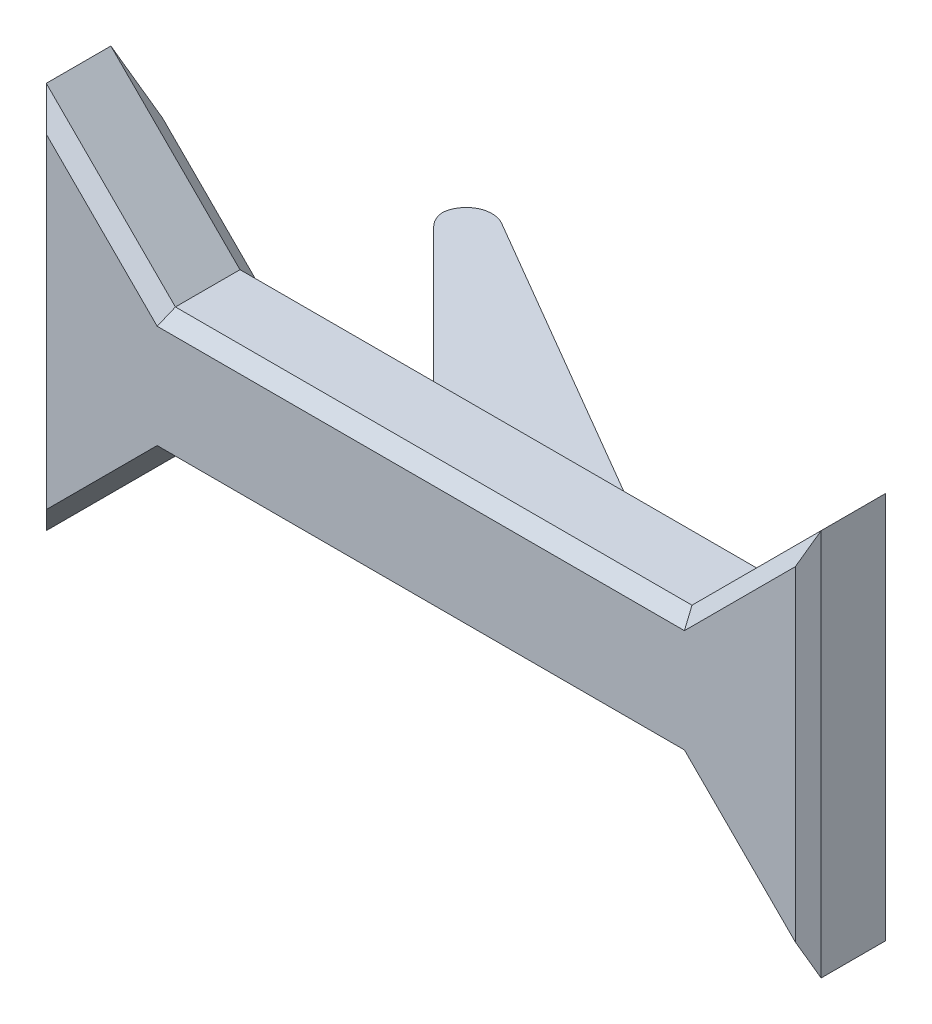
from build123d import *

# Parameters (mm, degrees)
SKETCH1_W           = 20
SKETCH1_H           = 5
BOSS_EXTRUDE1_DEPTH = 4
BOSS_EXTRUDE2_DEPTH = 2
CHAMFER1_SIZE       = 0.5
CHAMFER2_SIZE       = 1
CHAMFER3_SIZE       = 1
CHAMFER3_SIZE2      = 0.707106781
FILLET5_R           = 1


with BuildPart() as part:
    # Sketch1 → Boss-Extrude1 (new body)
    with BuildSketch(Plane.XY):
        Polygon((-15, 7.5), (-15, -7.5), (-10, -2.5), (-10, 2.5), align=None)
        Rectangle(SKETCH1_W, SKETCH1_H)
        Polygon((10, 2.5), (15, 7.5), (15, -7.5), (10, -2.5), align=None)
    extrude(amount=BOSS_EXTRUDE1_DEPTH)

    # Sketch4 → Boss-Extrude2 (add, symmetric)
    with BuildSketch(Plane(origin=(0, 0, 0), x_dir=(1, 0, 0), z_dir=(0, 1, 0))):
        Polygon((3.5, 0), (-8.5, 7), (-8.5, 5), (-3.5, 0), align=None)
    extrude(amount=BOSS_EXTRUDE2_DEPTH, both=True)

    # Chamfer1
    chamfer1_edges = [part.edges().sort_by_distance(p)[0] for p in [
        (-12.5, -5, 4),
        (0, -2.5, 4),
        (12.5, -5, 4),
        (15, 0, 4),
        (12.5, 5, 4),
        (0, 2.5, 4),
        (-12.5, 5, 4),
        (-15, 0, 4),
    ]]
    chamfer(chamfer1_edges, length=CHAMFER1_SIZE)

    # Chamfer2
    # the kernel refuses this chamfer: 1 mm, written as the material it takes off along each edge
    with BuildSketch(Plane(origin=(16.81845448, -9.31845448, 0), x_dir=(0.7071067811865414, 0.7071067811865538, 0), z_dir=(-0.7071067811865538, 0.7071067811865415, 0))) as chamfer2_piece_1_section:
        Polygon((CHAMFER2_SIZE, 0), (0, -CHAMFER2_SIZE), (0, 0), align=None)
    chamfer2_piece_1 = extrude(amount=12.214433788, mode=Mode.PRIVATE)
    chamfer2_piece_1 = split(chamfer2_piece_1, bisect_by=Plane(origin=(16.81845448, -5.40922724, 3.90922724), z_dir=(0, -0.7071067811865476, -0.7071067811865476)), keep=Keep.TOP, mode=Mode.PRIVATE)
    add(chamfer2_piece_1, mode=Mode.SUBTRACT)
    with BuildSketch(Plane(origin=(15, 10.071682988, 0), x_dir=(-1, 0, 0), z_dir=(0, -1, 0)), Plane(origin=(-15, 10.071682988, 0), x_dir=(0, 0, 1), z_dir=(0, -1, 0))) as chamfer2_piece_2:
        Polygon((CHAMFER2_SIZE, 0), (0, -CHAMFER2_SIZE), (0, 0), align=None)
    extrude(amount=20.143365976, mode=Mode.SUBTRACT)
    with BuildSketch(Plane(origin=(8.18154552, 0.68154552, 0), x_dir=(0.707106781186537, -0.7071067811865581, 0), z_dir=(0.7071067811865581, 0.707106781186537, 0))) as chamfer2_piece_3_section:
        Polygon((CHAMFER2_SIZE, 0), (0, -CHAMFER2_SIZE), (0, 0), align=None)
    chamfer2_piece_3 = extrude(amount=12.214433788, mode=Mode.PRIVATE)
    chamfer2_piece_3 = split(chamfer2_piece_3, bisect_by=Plane(origin=(8.18154552, 1.09077276, -0.40922724), z_dir=(0, 0.7071067811865476, -0.7071067811865476)), keep=Keep.TOP, mode=Mode.PRIVATE)
    add(chamfer2_piece_3, mode=Mode.SUBTRACT)
    with BuildSketch(Plane(origin=(12.571682988, 2.5, 0), x_dir=(0, -1, 0), z_dir=(-1, 0, 0))) as chamfer2_piece_4_section:
        Polygon((CHAMFER2_SIZE, 0), (0, CHAMFER2_SIZE), (0, 0), align=None)
    chamfer2_piece_4 = extrude(amount=25.143365976, mode=Mode.PRIVATE)
    chamfer2_piece_4 = split(chamfer2_piece_4, bisect_by=Plane(origin=(10.268509587, 2.5, 3.948297259), z_dir=(0.5038710255240867, 0, -0.8637789008984332)), keep=Keep.TOP, mode=Mode.PRIVATE)
    chamfer2_piece_4 = split(chamfer2_piece_4, bisect_by=Plane(origin=(12.282315632, 2.789367356, -0.40922724), z_dir=(-0.4999999999999927, 0.5000000000000075, -0.7071067811865475)), keep=Keep.TOP, mode=Mode.PRIVATE)
    add(chamfer2_piece_4, mode=Mode.SUBTRACT)
    with BuildSketch(Plane(origin=(12.571682988, 2.5, 0), x_dir=(0, -1, 0), z_dir=(-1, 0, 0))) as chamfer2_piece_5_section:
        Polygon((CHAMFER2_SIZE, 0), (0, CHAMFER2_SIZE), (0, 0), align=None)
    chamfer2_piece_5 = extrude(amount=25.143365976, mode=Mode.PRIVATE)
    chamfer2_piece_5 = split(chamfer2_piece_5, bisect_by=Plane(origin=(12.571682988, 2, 0), z_dir=(0, 1, 0)), keep=Keep.TOP, mode=Mode.PRIVATE)
    chamfer2_piece_5 = split(chamfer2_piece_5, bisect_by=Plane(origin=(12.282315632, 2.789367356, -0.40922724), z_dir=(-0.4999999999999927, 0.5000000000000075, -0.7071067811865475)), keep=Keep.TOP, mode=Mode.PRIVATE)
    chamfer2_piece_5 = split(chamfer2_piece_5, bisect_by=Plane(origin=(6.57520885, -3.496474138, 8.480295052), z_dir=(0.49999999999999395, 0.500000000000006, -0.7071067811865475)), keep=Keep.TOP, mode=Mode.PRIVATE)
    add(chamfer2_piece_5, mode=Mode.SUBTRACT)
    with BuildSketch(Plane(origin=(12.571682988, 2.5, 0), x_dir=(0, -1, 0), z_dir=(-1, 0, 0))) as chamfer2_piece_6_section:
        Polygon((CHAMFER2_SIZE, 0), (0, CHAMFER2_SIZE), (0, 0), align=None)
    chamfer2_piece_6 = extrude(amount=25.143365976, mode=Mode.PRIVATE)
    chamfer2_piece_6 = split(chamfer2_piece_6, bisect_by=Plane(origin=(4.535841494, 2.5, 8.035841494), z_dir=(-0.7071067811865487, 0, 0.7071067811865464)), keep=Keep.TOP, mode=Mode.PRIVATE)
    chamfer2_piece_6 = split(chamfer2_piece_6, bisect_by=Plane(origin=(6.57520885, -3.496474138, 8.480295052), z_dir=(0.49999999999999395, 0.500000000000006, -0.7071067811865475)), keep=Keep.TOP, mode=Mode.PRIVATE)
    add(chamfer2_piece_6, mode=Mode.SUBTRACT)
    with BuildSketch(Plane(origin=(-12.571682988, -2.5, 0), x_dir=(0, 1, 0), z_dir=(1, 0, 0))) as chamfer2_piece_7_section:
        Polygon((CHAMFER2_SIZE, 0), (0, CHAMFER2_SIZE), (0, 0), align=None)
    chamfer2_piece_7 = extrude(amount=25.143365976, mode=Mode.PRIVATE)
    chamfer2_piece_7 = split(chamfer2_piece_7, bisect_by=Plane(origin=(-8.035841494, -2.5, -4.535841494), z_dir=(-0.7071067811865487, 0, 0.7071067811865464)), keep=Keep.TOP, mode=Mode.PRIVATE)
    chamfer2_piece_7 = split(chamfer2_piece_7, bisect_by=Plane(origin=(-12.282315632, -2.789367356, -0.40922724), z_dir=(0.499999999999994, -0.5000000000000063, -0.7071067811865475)), keep=Keep.TOP, mode=Mode.PRIVATE)
    add(chamfer2_piece_7, mode=Mode.SUBTRACT)
    with BuildSketch(Plane(origin=(-12.571682988, -2.5, 0), x_dir=(0, 1, 0), z_dir=(1, 0, 0))) as chamfer2_piece_8_section:
        Polygon((CHAMFER2_SIZE, 0), (0, CHAMFER2_SIZE), (0, 0), align=None)
    chamfer2_piece_8 = extrude(amount=25.143365976, mode=Mode.PRIVATE)
    chamfer2_piece_8 = split(chamfer2_piece_8, bisect_by=Plane(origin=(-12.571682988, -2, 0), z_dir=(0, -1, 0)), keep=Keep.TOP, mode=Mode.PRIVATE)
    chamfer2_piece_8 = split(chamfer2_piece_8, bisect_by=Plane(origin=(-12.282315632, -2.789367356, -0.40922724), z_dir=(0.499999999999994, -0.5000000000000063, -0.7071067811865475)), keep=Keep.TOP, mode=Mode.PRIVATE)
    chamfer2_piece_8 = split(chamfer2_piece_8, bisect_by=Plane(origin=(-6.57520885, 3.496474138, 8.480295052), z_dir=(-0.49999999999999584, -0.5000000000000047, -0.7071067811865475)), keep=Keep.TOP, mode=Mode.PRIVATE)
    add(chamfer2_piece_8, mode=Mode.SUBTRACT)
    with BuildSketch(Plane(origin=(-12.571682988, -2.5, 0), x_dir=(0, 1, 0), z_dir=(1, 0, 0))) as chamfer2_piece_9_section:
        Polygon((CHAMFER2_SIZE, 0), (0, CHAMFER2_SIZE), (0, 0), align=None)
    chamfer2_piece_9 = extrude(amount=25.143365976, mode=Mode.PRIVATE)
    chamfer2_piece_9 = split(chamfer2_piece_9, bisect_by=Plane(origin=(-8.491307514, -2.5, -6.994929383), z_dir=(0.5038710255240867, 0, -0.8637789008984332)), keep=Keep.TOP, mode=Mode.PRIVATE)
    chamfer2_piece_9 = split(chamfer2_piece_9, bisect_by=Plane(origin=(-6.57520885, 3.496474138, 8.480295052), z_dir=(-0.49999999999999584, -0.5000000000000047, -0.7071067811865475)), keep=Keep.TOP, mode=Mode.PRIVATE)
    add(chamfer2_piece_9, mode=Mode.SUBTRACT)
    with BuildSketch(Plane(origin=(-16.81845448, -9.31845448, 0), x_dir=(-0.7071067811865389, 0.7071067811865562, 0), z_dir=(0.7071067811865562, 0.7071067811865389, 0))) as chamfer2_piece_10_section:
        Polygon((CHAMFER2_SIZE, 0), (0, CHAMFER2_SIZE), (0, 0), align=None)
    chamfer2_piece_10 = extrude(amount=12.214433788, mode=Mode.PRIVATE)
    chamfer2_piece_10 = split(chamfer2_piece_10, bisect_by=Plane(origin=(-16.81845448, -5.40922724, 3.90922724), z_dir=(0, -0.7071067811865476, -0.7071067811865476)), keep=Keep.TOP, mode=Mode.PRIVATE)
    add(chamfer2_piece_10, mode=Mode.SUBTRACT)
    with BuildSketch(Plane(origin=(-8.18154552, 0.68154552, 0), x_dir=(0, 0, 1), z_dir=(-0.707106781186556, 0.707106781186539, 0))) as chamfer2_piece_11_section:
        Polygon((CHAMFER2_SIZE, 0), (0, -CHAMFER2_SIZE), (0, 0), align=None)
    chamfer2_piece_11 = extrude(amount=12.214433788, mode=Mode.PRIVATE)
    chamfer2_piece_11 = split(chamfer2_piece_11, bisect_by=Plane(origin=(-8.18154552, 1.09077276, -0.40922724), z_dir=(0, 0.7071067811865476, -0.7071067811865476)), keep=Keep.TOP, mode=Mode.PRIVATE)
    add(chamfer2_piece_11, mode=Mode.SUBTRACT)

    # Chamfer3
    chamfer3_edges = [part.edges().sort_by_distance(p)[0] for p in [
        (-3.5, 0, 0),
    ]]
    chamfer3_side = [part.faces().sort_by_distance(p)[0] for p in [
        (-5.967078189, 0, -2.467078189),
    ]]
    chamfer(chamfer3_edges, length=CHAMFER3_SIZE, length2=CHAMFER3_SIZE2, reference=chamfer3_side[0])

    # Fillet5
    # the kernel refuses this fillet: 1 mm, written as the material it takes off along each edge
    with BuildSketch(Plane(origin=(-8.5, -6.352592498, -7), x_dir=(0, 0, 1), z_dir=(0, 1, 0))) as fillet5_piece_1:
        with BuildLine():
            CenterArc((FILLET5_R * 1.74103699912, FILLET5_R), FILLET5_R, 149.743562836, 120.256437164)
            Line((FILLET5_R * 0.877258098223, FILLET5_R * 1.50387102552), (0, 0))
            Line((0, 0), (FILLET5_R * 1.74103699912, 0))
        make_face()
    extrude(amount=12.705184996, mode=Mode.SUBTRACT)
    with BuildSketch(Plane(origin=(-8.5, -3.035533906, -5), x_dir=(0, 0, -1), z_dir=(0, 1, 0))) as fillet5_piece_2:
        with BuildLine():
            CenterArc((FILLET5_R * 0.414213562373, -FILLET5_R), FILLET5_R, 90, 45)
            Line((-FILLET5_R * 0.292893218813, -FILLET5_R * 0.292893218813), (0, 0))
            Line((0, 0), (FILLET5_R * 0.414213562373, 0))
        make_face()
    extrude(amount=6.071067812, mode=Mode.SUBTRACT)


solid = part.part
